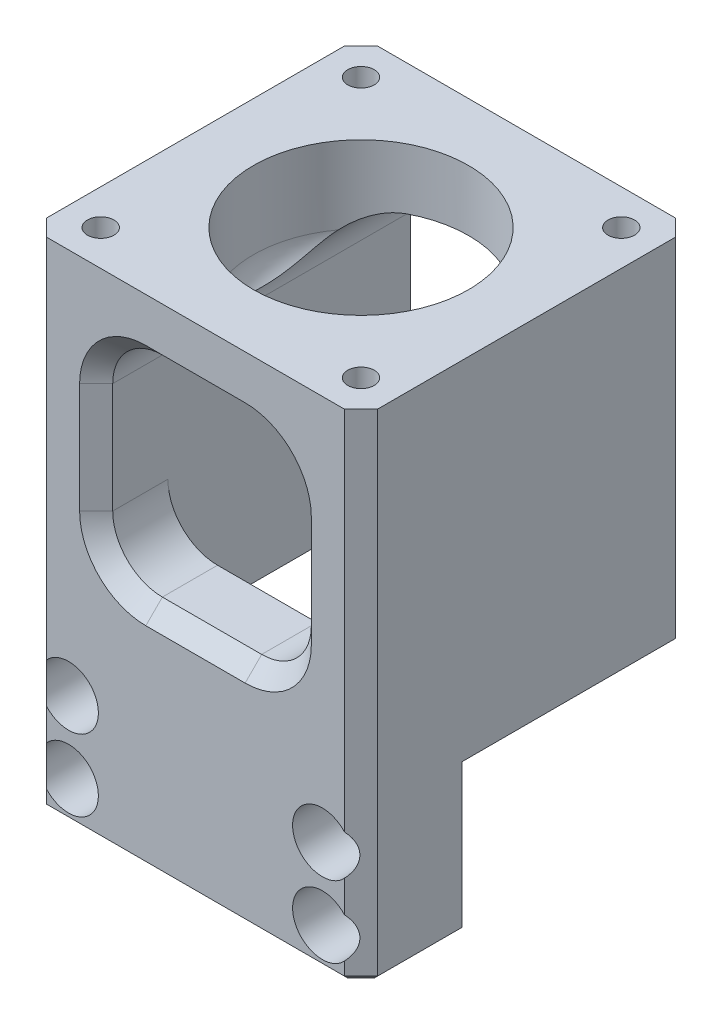
from build123d import *
from build123d.topology import SkipClean

# Parameters (mm, degrees)
SKETCH1_W               = 60
SKETCH1_H               = 60
BOSS_EXTRUDE1_DEPTH     = 90
CUT_EXTRUDE1_DEPTH      = 100.498743711
CUT_EXTRUDE1_DEPTH_BACK = 100.498743711
SKETCH2_W               = 40.7
SKETCH2_H               = 26
SKETCH4_W               = 36
SKETCH4_H               = 38
CUT_EXTRUDE2_DEPTH      = 113.249721603
SKETCH5_W               = 36
SKETCH5_H               = 34
CUT_EXTRUDE3_DEPTH      = 79
SKETCH6_R               = 19.5
CUT_EXTRUDE4_DEPTH      = 20
FILLET2_R               = 6
FILLET3_START           = -30
FILLET3_DEPTH           = 60
FILLET3_2_DEPTH         = 13
FILLET3_START_2         = 17
FILLET3_3_DEPTH         = 13
CHAMFER1_SIZE           = 3
SKETCH7_R               = 3.05
CUT_EXTRUDE5_DEPTH      = 104.230276693
SKETCH8_R               = 5.4
CUT_EXTRUDE6_DEPTH      = 9.5
CHAMFER2_SIZE           = 1
SKETCH10_R              = 2.4
CUT_EXTRUDE7_DEPTH      = 23
CHAMFER3_SIZE           = 3
SKETCH11_R              = 4
CUT_EXTRUDE8_DEPTH      = 40
SKETCH12_R              = 2
CUT_EXTRUDE9_DEPTH      = 11


with BuildPart() as part:
    # Sketch1 → Boss-Extrude1 (new body)
    with BuildSketch(Plane(origin=(0, 0, 0), x_dir=(1, 0, 0), z_dir=(0, 1, 0))):
        Rectangle(SKETCH1_W, SKETCH1_H)
    extrude(amount=BOSS_EXTRUDE1_DEPTH)

    # Sketch2 → Cut-Extrude1 (cut, two sides: drawn at the far end of the back side and taken through both)
    with BuildSketch(Plane(origin=(0, 0, 0), x_dir=(0, 0, -1), z_dir=(1, 0, 0)).offset(-CUT_EXTRUDE1_DEPTH_BACK)):
        with Locations((9.65, 13)):
            Rectangle(SKETCH2_W, SKETCH2_H)
    extrude(amount=CUT_EXTRUDE1_DEPTH + CUT_EXTRUDE1_DEPTH_BACK, mode=Mode.SUBTRACT)

    # Sketch4 → Cut-Extrude2 (cut, through all)
    with BuildSketch(Plane(origin=(0, 0, -30), x_dir=(-1, 0, 0), z_dir=(0, 0, -1))):
        with Locations((0, 60)):
            Rectangle(SKETCH4_W, SKETCH4_H)
    extrude(amount=-CUT_EXTRUDE2_DEPTH, mode=Mode.SUBTRACT)

    # Sketch5 → Cut-Extrude3 (cut)
    with BuildSketch(Plane.XZ):
        Rectangle(SKETCH5_W, SKETCH5_H)
    extrude(amount=-CUT_EXTRUDE3_DEPTH, mode=Mode.SUBTRACT)

    # Sketch6 → Cut-Extrude4 (cut)
    with BuildSketch(Plane(origin=(0, 90, 0), x_dir=(1, 0, 0), z_dir=(0, 1, 0))):
        with Locations(Location((0, 0, 0), (0, 0, 270))):
            Circle(SKETCH6_R)
    extrude(amount=-CUT_EXTRUDE4_DEPTH, mode=Mode.SUBTRACT)

    # Fillet2
    # the kernel refuses this fillet: 6 mm, written as the material it adds along each edge
    with BuildSketch(Plane(origin=(0, 70, 0), x_dir=(-0.39557733724118155, 0, -0.9184326705105695), z_dir=(0.9184326705105695, 0, -0.39557733724118155))) as fillet2_piece_1_section:
        with BuildLine():
            CenterArc((19.5 - FILLET2_R, FILLET2_R), FILLET2_R, 270, 90)
            Line((19.5 - FILLET2_R, 0), (19.5, 0))
            Line((19.5, 0), (19.5, FILLET2_R))
        make_face()
    fillet2_piece_1 = revolve(axis=Axis((0, 70, 0), (0, 1, 0)), revolution_arc=133.396028061, mode=Mode.PRIVATE)
    fillet2_piece_1 = split(fillet2_piece_1, bisect_by=Plane(origin=(-18, 70, 0), z_dir=(-1, 0, 0)), keep=Keep.TOP, mode=Mode.PRIVATE)
    add(fillet2_piece_1)
    with BuildSketch(Plane(origin=(0, 70, 0), x_dir=(0.39557733724118166, 0, 0.9184326705105695), z_dir=(-0.9184326705105695, 0, 0.39557733724118166))) as fillet2_piece_2_section:
        with BuildLine():
            CenterArc((19.5 - FILLET2_R, FILLET2_R), FILLET2_R, 270, 90)
            Line((19.5 - FILLET2_R, 0), (19.5, 0))
            Line((19.5, 0), (19.5, FILLET2_R))
        make_face()
    fillet2_piece_2 = revolve(axis=Axis((0, 70, 0), (0, 1, 0)), revolution_arc=133.396028061, mode=Mode.PRIVATE)
    fillet2_piece_2 = split(fillet2_piece_2, bisect_by=Plane(origin=(18, 70, 0), z_dir=(1, 0, 0)), keep=Keep.TOP, mode=Mode.PRIVATE)
    add(fillet2_piece_2)

    # Fillet3: read off the stored shape, not the designer's step
    # Fillet3 outline → Fillet3 (add)
    with BuildSketch(Plane.XY.offset(FILLET3_START)):
        with BuildLine():
            ThreePointArc((-18, 70), (-15.363961031, 76.363961031), (-9, 79))
            Line((-9, 79), (-18, 79))
            Line((-18, 79), (-18, 70))
        make_face()
        with BuildLine():
            Line((18, 79), (9, 79))
            ThreePointArc((9, 79), (15.363961031, 76.363961031), (18, 70))
            Line((18, 70), (18, 79))
        make_face()
    extrude(amount=FILLET3_DEPTH)

    # Fillet3 2 outline → Fillet3 2 (add)
    with BuildSketch(Plane.XY.offset(FILLET3_START)):
        with BuildLine():
            ThreePointArc((-9, 41), (-15.363961031, 43.636038969), (-18, 50))
            Line((-18, 50), (-18, 41))
            Line((-18, 41), (-9, 41))
        make_face()
        with BuildLine():
            Line((18, 41), (18, 50))
            ThreePointArc((18, 50), (15.363961031, 43.636038969), (9, 41))
            Line((9, 41), (18, 41))
        make_face()
    extrude(amount=FILLET3_2_DEPTH)

    # Fillet3 3 outline → Fillet3 3 (add)
    with BuildSketch(Plane.XY.offset(FILLET3_START_2)):
        with BuildLine():
            ThreePointArc((-9, 41), (-15.363961031, 43.636038969), (-18, 50))
            Line((-18, 50), (-18, 41))
            Line((-18, 41), (-9, 41))
        make_face()
        with BuildLine():
            Line((18, 41), (18, 50))
            ThreePointArc((18, 50), (15.363961031, 43.636038969), (9, 41))
            Line((9, 41), (18, 41))
        make_face()
    extrude(amount=FILLET3_3_DEPTH)

    # Fillet3 4 outline → Fillet3 4 (revolve, cut)
    with SkipClean():  # the faces are left unmerged after this step: merging them gives an invalid solid
        with BuildSketch(Plane.XY):
            with BuildLine():
                Line((0, 71.827932396), (17.812058894, 71.827932396))
                ThreePointArc((17.812058894, 71.827932396), (19.062029907, 73.749705949), (19.5, 76))
                Line((19.5, 76), (19.5, 79))
                Line((19.5, 79), (0, 79))
                Line((0, 79), (0, 71.827932396))
            make_face()
        revolve(axis=Axis((0, 0, 0), (0, 1, 0)), mode=Mode.SUBTRACT)
    add(part.part.scale(1), mode=Mode.REPLACE)  # the faces are merged on a copy

    # Chamfer1
    chamfer1_edges = [part.edges().sort_by_distance(p)[0] for p in [
        (-30, 58, -30),
        (30, 58, -30),
        (30, 45, 30),
        (-30, 45, 30),
    ]]
    chamfer(chamfer1_edges, length=CHAMFER1_SIZE)

    # Sketch7 → Cut-Extrude5 (cut, through all)
    with BuildSketch(Plane(origin=(0, 0, 10.7), x_dir=(-1, 0, 0), z_dir=(0, 0, -1))):
        with Locations((-23, 20)):
            Circle(SKETCH7_R)
        with Locations((-23, 7)):
            Circle(SKETCH7_R)
        with Locations((23, 20)):
            Circle(SKETCH7_R)
        with Locations((23, 7)):
            Circle(SKETCH7_R)
    extrude(amount=-CUT_EXTRUDE5_DEPTH, mode=Mode.SUBTRACT)

    # Sketch8 → Cut-Extrude6 (cut)
    with BuildSketch(Plane.XY.offset(30)):
        with Locations((-23, 20)):
            Circle(SKETCH8_R)
        with Locations((23, 20)):
            Circle(SKETCH8_R)
        with Locations((23, 7)):
            Circle(SKETCH8_R)
        with Locations((-23, 7)):
            Circle(SKETCH8_R)
    extrude(amount=-CUT_EXTRUDE6_DEPTH, mode=Mode.SUBTRACT)

    # Chamfer2
    chamfer2_edges = [part.edges().sort_by_distance(p)[0] for p in [
        (-30, 0, 18.85),
        (-30, 26, -8.15),
        (0, 26, -30),
        (30, 26, -8.15),
        (28.5, 26, -28.5),
        (-28.5, 26, -28.5),
        (30, 0, 18.85),
        (0, 0, 30),
        (28.5, 0, 28.5),
        (-28.5, 0, 28.5),
        (-24, 0, 10.7),
        (-30, 13, 10.7),
        (30, 13, 10.7),
        (24, 0, 10.7),
        (-18, 0, 13.85),
        (18, 0, 13.85),
        (0, 0, 17),
    ]]
    chamfer(chamfer2_edges, length=CHAMFER2_SIZE)

    # Sketch10 → Cut-Extrude7 (cut)
    with BuildSketch(Plane(origin=(0, 90, 0), x_dir=(1, 0, 0), z_dir=(0, 1, 0))):
        with Locations(Location((-23.59, 23.59, 0), (0, 0, 270))):
            Circle(SKETCH10_R)
        with Locations(Location((23.59, 23.59, 0), (0, 0, 270))):
            Circle(SKETCH10_R)
        with Locations(Location((23.59, -23.59, 0), (0, 0, 270))):
            Circle(SKETCH10_R)
        with Locations(Location((-23.59, -23.59, 0), (0, 0, 270))):
            Circle(SKETCH10_R)
    extrude(amount=-CUT_EXTRUDE7_DEPTH, mode=Mode.SUBTRACT)

    # Chamfer3
    chamfer3_edges = [part.edges().sort_by_distance(p)[0] for p in [
        (-18, 60, 30),
        (-18, 60, -30),
        (0, 79, 30),
        (18, 60, -30),
        (18, 60, 30),
        (0, 41, 30),
        (0, 41, -30),
        (-15.363961031, 76.363961031, -30),
        (-15.363961031, 76.363961031, 30),
        (15.363961031, 76.363961031, -30),
        (15.363961031, 76.363961031, 30),
        (15.363961031, 43.636038969, 30),
        (15.363961031, 43.636038969, -30),
        (-15.363961031, 43.636038969, -30),
        (-15.363961031, 43.636038969, 30),
        (0, 79, -30),
    ]]
    chamfer(chamfer3_edges, length=CHAMFER3_SIZE)

    # Sketch11 → Cut-Extrude8 (cut)
    with BuildSketch(Plane.XZ):
        with Locations(Location((0, 22.24, 0), (0, 0, 270))):
            Circle(SKETCH11_R)
    extrude(amount=-CUT_EXTRUDE8_DEPTH, mode=Mode.SUBTRACT)

    # Sketch12 → Cut-Extrude9 (cut)
    with BuildSketch(Plane.XZ):
        with Locations(Location((-12, 22.24, 0), (0, 0, 270))):
            Circle(SKETCH12_R)
        with Locations(Location((12, 22.24, 0), (0, 0, 270))):
            Circle(SKETCH12_R)
    extrude(amount=-CUT_EXTRUDE9_DEPTH, mode=Mode.SUBTRACT)


solid = part.part
